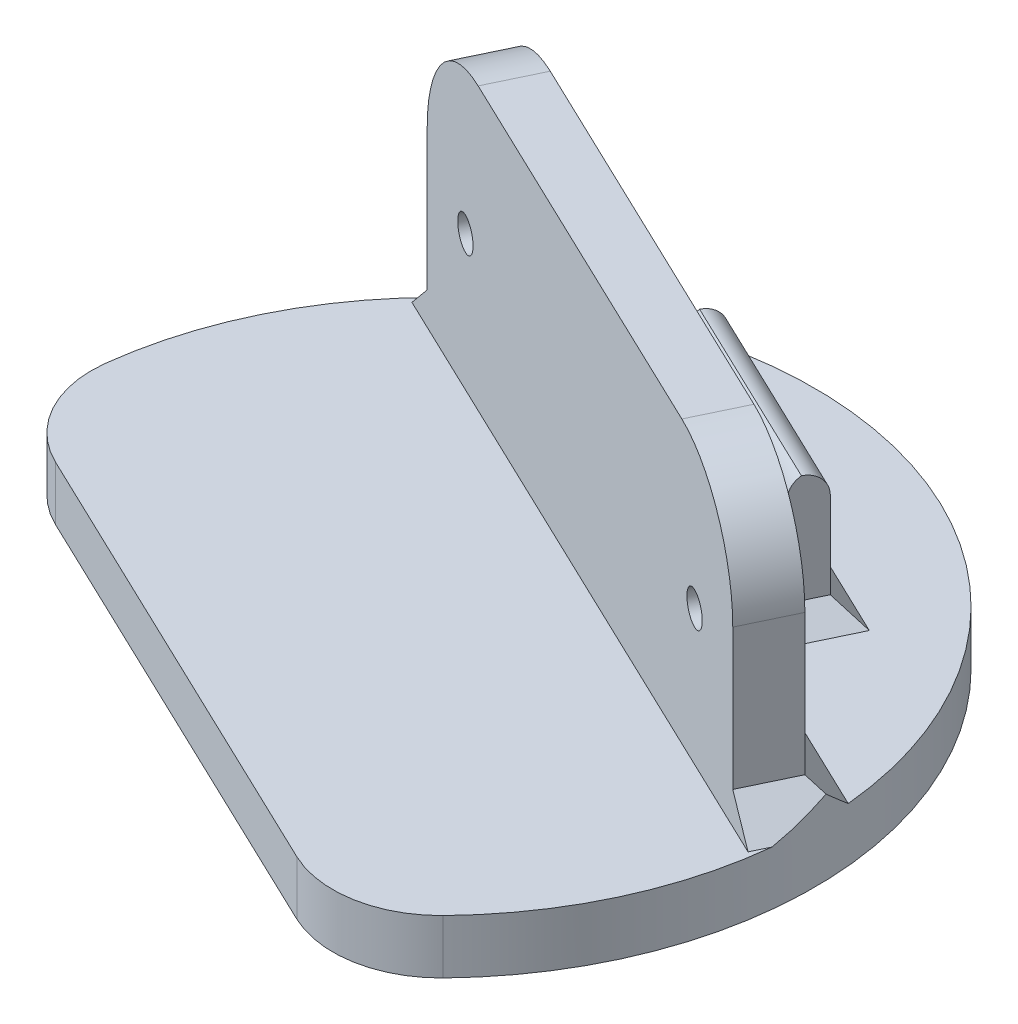
from build123d import *

# Parameters (mm, degrees)
ESBO_O1_R                 = 35
RESSALTO_EXTRUS_O1_DEPTH  = 5
ESBO_O3_R                 = 10
RESSALTO_EXTRUS_O3_DEPTH  = 13
ESBO_O4_R                 = 5
CORTE_EXTRUS_O1_DEPTH     = 13
RESSALTO_EXTRUS_O5_DEPTH  = 13
CORTE_EXTRUS_O6_START     = -11
CORTE_EXTRUS_O6_OUTLINE_R = 2
CORTE_EXTRUS_O6_DEPTH     = 22
CORTE_EXTRUS_O8_DEPTH     = 68.852738868
RESSALTO_EXTRUS_O7_DEPTH  = 26
ESBO_O19_R                = 1.5
CORTE_EXTRUS_O9_DEPTH     = 26
FILETE1_R                 = 10
FILETE2_R                 = 10
RESSALTO_EXTRUS_O9_DEPTH  = 12
CORTE_EXTRUS_O11_REACH    = 75.407
ESBO_O26_R                = 3
CHANFRO7_SIZE             = 3
CHANFRO8_SIZE             = 3
CHANFRO9_SIZE             = 3
CHANFRO10_SIZE            = 2
FILETE5_R                 = 2
FILETE6_R                 = 2
CHANFRO11_SIZE            = 2


with BuildPart() as part:
    # Esboço1 → Ressalto-extrusão1 (new body)
    with BuildSketch(Plane(origin=(0, 0, 0), x_dir=(1, 0, 0), z_dir=(0, 1, 0))):
        with Locations(Location((0, 0, 0), (0, 0, 270))):
            Circle(ESBO_O1_R)
    extrude(amount=RESSALTO_EXTRUS_O1_DEPTH)

    # Esboço3 → Ressalto-extrusão3 (add)
    with BuildSketch(Plane.XZ):
        with Locations(Location((0, 0, 0), (0, 0, 90))):
            Circle(ESBO_O3_R)
    extrude(amount=RESSALTO_EXTRUS_O3_DEPTH)

    # Esboço4 → Corte-extrusão1 (cut)
    with BuildSketch(Plane(origin=(0, -13, 0), x_dir=(-1, 0, 0), z_dir=(0, -1, 0))):
        with Locations(Location((0, 0, 0), (0, 0, 90))):
            Circle(ESBO_O4_R)
    extrude(amount=-CORTE_EXTRUS_O1_DEPTH, mode=Mode.SUBTRACT)

    # Esboço11 → Ressalto-extrusão5 (add)
    with BuildSketch(Plane.XZ):
        Polygon((10.27244843, -26.12425699), (10.703764509, -27.026457876), (14.312568056, -25.301193562), (13.449935899, -23.496791788), (9.841132351, -25.222056103), align=None)
    extrude(amount=RESSALTO_EXTRUS_O5_DEPTH)

    # Corte-extrusão6: read off the stored shape, not the designer's step
    # Corte-extrusão6 outline → Corte-extrusão6 (cut)
    with BuildSketch(Plane(origin=(0, 0, 0), x_dir=(0.9022008868624063, 0, 0.4313160786994702), z_dir=(0.43131607869947014, 0, -0.9022008868624064)).offset(CORTE_EXTRUS_O6_START)):
        with Locations((0, 7.014981428)):
            Circle(CORTE_EXTRUS_O6_OUTLINE_R)
    extrude(amount=CORTE_EXTRUS_O6_DEPTH, mode=Mode.SUBTRACT)

    # 3DSketch5 → Corte-extrusão8 (cut, through all)
    with BuildSketch(Plane(origin=(-8.247671749, -6.480100675, 16.008238046), x_dir=(0.7047714310013795, 0.6243195323179013, 0.3369307816312202), z_dir=(-0.43131607869947175, 0, 0.9022008868624055))):
        Polygon((0, 0), (-30.606987597, 24.461465293), (-10.703733889, 49.365069068), (51.063459474, 0), (31.160205765, -24.903603774), align=None)
    extrude(amount=CORTE_EXTRUS_O8_DEPTH, mode=Mode.SUBTRACT)

    # Esboço18 → Ressalto-extrusão7 (add)
    with BuildSketch(Plane(origin=(0, 5, 0), x_dir=(1, 0, 0), z_dir=(0, 1, 0))):
        Polygon((4.313160787, 9.022008869), (31.379187393, -3.917473492), (33.535767786, 0.593530942), (-20.596285425, 26.472495664), (-22.752865819, 21.96149123), align=None)
    extrude(amount=RESSALTO_EXTRUS_O7_DEPTH)

    # Esboço19 → Corte-extrusão9 (cut)
    with BuildSketch(Plane(origin=(4.313160787, 0, -9.022008869), x_dir=(0.9022008868624055, 0, 0.43131607869947175), z_dir=(-0.43131607869947175, 0, 0.9022008868624055))):
        with Locations((-22.5, 17.5)):
            Circle(ESBO_O19_R)
        with Locations((22.5, 17.5)):
            Circle(ESBO_O19_R)
    extrude(amount=-CORTE_EXTRUS_O9_DEPTH, mode=Mode.SUBTRACT)

    # Filete1
    filete1_edges = [part.edges().sort_by_distance(p)[0] for p in [
        (32.45747759, 31, 1.661971275),
        (-21.674575622, 31, -24.216993447),
    ]]
    fillet(filete1_edges, radius=FILETE1_R)

    # Filete2
    filete2_edges = [part.edges().sort_by_distance(p)[0] for p in [
        (19.317369696, 2.5, 29.18628493),
        (-34.844748529, 2.5, 3.292946997),
    ]]
    fillet(filete2_edges, radius=FILETE2_R)

    # Esboço25 → Ressalto-extrusão9 (add)
    with BuildSketch(Plane(origin=(0, 5, 0), x_dir=(1, 0, 0), z_dir=(0, 1, 0))):
        Polygon((8.981926733, 18.787851102), (-0.040082135, 23.101011889), (1.253866101, 25.80761455), (19.297883838, 17.181292976), (18.003935602, 14.474690315), align=None)
    extrude(amount=RESSALTO_EXTRUS_O9_DEPTH)

    # Esboço26 → Corte-extrusão11 (cut, up to next)
    with BuildSketch(Plane(origin=(10.275874969, 0, -21.494453763), x_dir=(-0.902200886862406, 0, -0.4313160786994711), z_dir=(0.4313160786994711, 0, -0.902200886862406)), mode=Mode.PRIVATE) as corte_extrus_o11_sk1:
        with Locations((0, 11)):
            Circle(ESBO_O26_R)
    corte_extrus_o11_tool1 = extrude(corte_extrus_o11_sk1.sketch, amount=-CORTE_EXTRUS_O11_REACH, mode=Mode.PRIVATE) & part.part
    add(corte_extrus_o11_tool1.solids().sort_by_distance((10.275875, 11, -21.494454))[0], mode=Mode.SUBTRACT)

    # Chanfro7
    chanfro7_edges = [part.edges().sort_by_distance(p)[0] for p in [
        (6.46974118, 5, -13.533013303),
    ]]
    chamfer(chanfro7_edges, length=CHANFRO7_SIZE)

    # Chanfro8
    # the kernel refuses this chamfer: 3 mm, written as the material it adds along each edge
    with BuildSketch(Plane(origin=(38.157340689, 5, -10.26065762), x_dir=(0.9022008868624055, 0, 0.43131607869947186), z_dir=(-0.4313160786994719, 0, 0.9022008868624055))) as chanfro8_piece_1_section:
        Polygon((CHANFRO8_SIZE, 0), (0, CHANFRO8_SIZE), (0, 0), align=None)
    chanfro8_piece_1 = extrude(amount=15.715048964, mode=Mode.PRIVATE)
    chanfro8_piece_1 = split(chanfro8_piece_1, bisect_by=Plane(origin=(36.493528356, 1.142475518, -6.780395611), z_dir=(-0.30498652408318644, -0.7071067811865479, 0.6379523650929244)), keep=Keep.TOP, mode=Mode.PRIVATE)
    chanfro8_piece_1 = chanfro8_piece_1 & Plane(origin=(0, 5, 0), x_dir=(0, 0, 1), z_dir=(0, -1, 0)) * Cylinder(35, 44, mode=Mode.PRIVATE)
    chanfro8_piece_1 = split(chanfro8_piece_1, bisect_by=Plane(origin=(33.535767786, 5, -0.593530942), z_dir=(0.4313160786994711, 0, -0.9022008868624058)), keep=Keep.TOP, mode=Mode.PRIVATE)
    add(chanfro8_piece_1)
    with BuildSketch(Plane(origin=(38.157340689, 5, -10.26065762), x_dir=(0.9022008868624055, 0, 0.43131607869947186), z_dir=(-0.4313160786994719, 0, 0.9022008868624055))) as chanfro8_piece_2_section:
        Polygon((CHANFRO8_SIZE, 0), (0, CHANFRO8_SIZE), (0, 0), align=None)
    chanfro8_piece_2 = extrude(amount=15.715048964, mode=Mode.PRIVATE)
    chanfro8_piece_2 = split(chanfro8_piece_2, bisect_by=Plane(origin=(36.493528356, 1.142475518, -6.780395611), z_dir=(-0.30498652408318644, -0.7071067811865479, 0.6379523650929244)), keep=Keep.TOP, mode=Mode.PRIVATE)
    chanfro8_piece_2 = chanfro8_piece_2 & Plane(origin=(0, 5, 0), x_dir=(0, 0, 1), z_dir=(0, -1, 0)) * Cylinder(35, 44, mode=Mode.PRIVATE)
    chanfro8_piece_2 = split(chanfro8_piece_2, bisect_by=Plane(origin=(33.535767786, 5, -0.593530942), z_dir=(-0.4313160786994711, 0, 0.9022008868624058)), keep=Keep.TOP, mode=Mode.PRIVATE)
    add(chanfro8_piece_2)

    # Chanfro9
    # the kernel refuses this chamfer: 3 mm, written as the material it adds along each edge
    with BuildSketch(Plane(origin=(-22.752865819, 5, -21.96149123), x_dir=(0, 1, 0), z_dir=(0.431316078699471, 0, -0.902200886862406))) as chanfro9_piece_1_section:
        Polygon((CHANFRO9_SIZE, 0), (0, -CHANFRO9_SIZE), (0, 0), align=None)
    chanfro9_piece_1 = extrude(amount=15.715048964, mode=Mode.PRIVATE)
    chanfro9_piece_1 = split(chanfro9_piece_1, bisect_by=Plane(origin=(-20.596285425, 5, -26.472495664), z_dir=(-0.4313160786994711, 0, 0.9022008868624058)), keep=Keep.TOP, mode=Mode.PRIVATE)
    chanfro9_piece_1 = split(chanfro9_piece_1, bisect_by=Plane(origin=(-21.027601504, 9, -25.570294777), z_dir=(-0.30498652408290505, -0.7071067811867798, 0.6379523650928014)), keep=Keep.TOP, mode=Mode.PRIVATE)
    chanfro9_piece_1 = chanfro9_piece_1 & Plane(origin=(0, 5, 0), x_dir=(0, 0, 1), z_dir=(0, -1, 0)) * Cylinder(35, 44, mode=Mode.PRIVATE)
    add(chanfro9_piece_1)
    with BuildSketch(Plane(origin=(-22.752865819, 5, -21.96149123), x_dir=(0, 1, 0), z_dir=(0.431316078699471, 0, -0.902200886862406))) as chanfro9_piece_2_section:
        Polygon((CHANFRO9_SIZE, 0), (0, -CHANFRO9_SIZE), (0, 0), align=None)
    chanfro9_piece_2 = extrude(amount=15.715048964, mode=Mode.PRIVATE)
    chanfro9_piece_2 = split(chanfro9_piece_2, bisect_by=Plane(origin=(-20.596285425, 5, -26.472495664), z_dir=(0.4313160786994711, 0, -0.9022008868624058)), keep=Keep.TOP, mode=Mode.PRIVATE)
    chanfro9_piece_2 = split(chanfro9_piece_2, bisect_by=Plane(origin=(-21.027601504, 9, -25.570294777), z_dir=(-0.30498652408290505, -0.7071067811867798, 0.6379523650928014)), keep=Keep.TOP, mode=Mode.PRIVATE)
    chanfro9_piece_2 = chanfro9_piece_2 & Plane(origin=(0, 5, 0), x_dir=(0, 0, 1), z_dir=(0, -1, 0)) * Cylinder(35, 44, mode=Mode.PRIVATE)
    add(chanfro9_piece_2)

    # Chanfro10
    chanfro10_edges = [part.edges().sort_by_distance(p)[0] for p in [
        (18.65090972, 5, -15.827991645),
        (10.275874969, 5, -21.494453763),
        (0.606891983, 5, -24.454313219),
        (8.981926733, 5, -18.787851102),
    ]]
    chamfer(chanfro10_edges, length=CHANFRO10_SIZE)

    # Filete5
    filete5_edges = [part.edges().sort_by_distance(p)[0] for p in [
        (10.275874969, 17, -21.494453763),
    ]]
    fillet(filete5_edges, radius=FILETE5_R)

    # Filete6
    # the kernel refuses this fillet: 2 mm, written as the material it takes off along each edge
    with BuildSketch(Plane(origin=(21.910580039, 17, -12.607036909), x_dir=(0.4313160786994712, -7.105427357600661e-14, -0.9022008868624057), z_dir=(-0.9022008868624058, 0, -0.4313160786994713))) as filete6_piece_1:
        with BuildLine():
            CenterArc((2, 1.732050808), FILETE6_R, 180, 60)
            Line((0, 1.732050808), (-0.04, 1.732050808))
            Line((-0.04, 1.732050808), (-0.04, 0))
            Line((-0.04, 0), (0, -0.04))
            ThreePointArc((0, -0.04), (0.5, -0.04), (0.98, -0.034641016))
            Line((0.98, -0.034641016), (1, 0))
        make_face()
    extrude(amount=28.660254038, mode=Mode.SUBTRACT)

    # Chanfro11
    chanfro11_edges = [part.edges().sort_by_distance(p)[0] for p in [
        (10.27244843, 0, -26.12425699),
        (12.508166282, 0, -26.163825719),
        (13.881251977, 0, -24.398992675),
        (11.645534125, 0, -24.359423945),
    ]]
    chamfer(chanfro11_edges, length=CHANFRO11_SIZE)


solid = part.part
